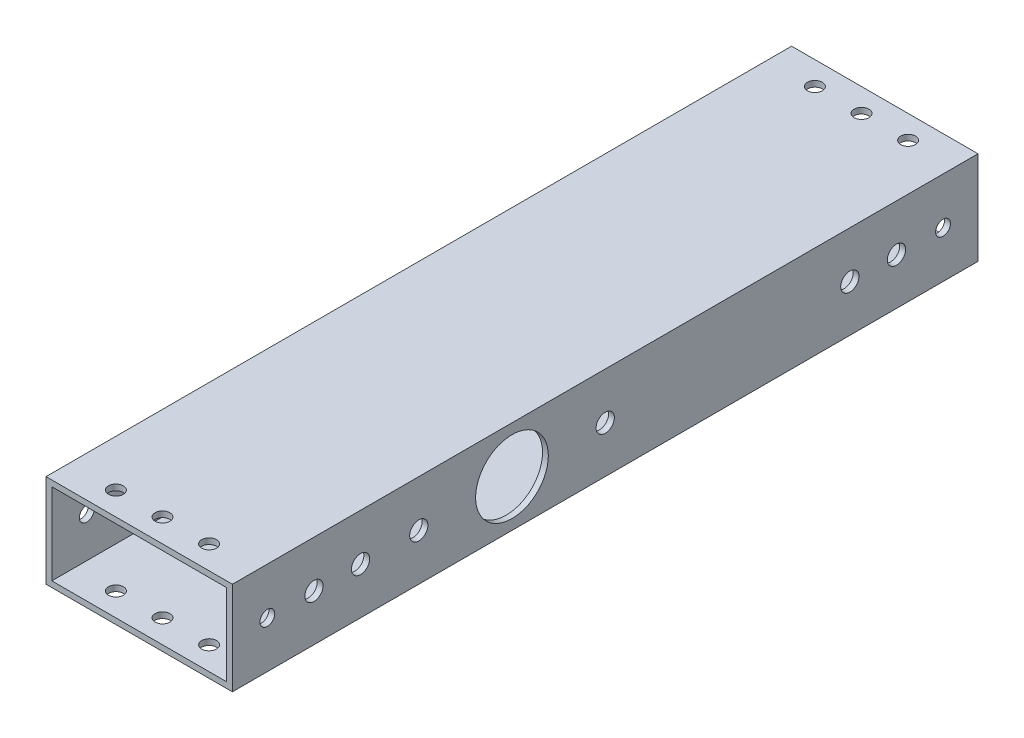
from build123d import *

# Parameters (mm, degrees)
SKETCH1_W           = 50.8
SKETCH1_H           = 25.4
SKETCH1_W_2         = 47.625
SKETCH1_H_2         = 22.225
BOSS_EXTRUDE1_DEPTH = 101.6
SKETCH2_R           = 2.0193
SKETCH2_R_2         = 2.4892
CUT_EXTRUDE1_DEPTH  = 115.3
SKETCH3_R           = 2.0193
CUT_EXTRUDE2_DEPTH  = 108.763073453
SKETCH4_R           = 9.906
SKETCH4_R_2         = 2.4892
CUT_EXTRUDE3_DEPTH  = 115.3


with BuildPart() as part:
    # Sketch1 → Boss-Extrude1 (new, symmetric)
    with BuildSketch(Plane.XY):
        Rectangle(SKETCH1_W, SKETCH1_H)
        Rectangle(SKETCH1_W_2, SKETCH1_H_2, mode=Mode.SUBTRACT)
    extrude(amount=BOSS_EXTRUDE1_DEPTH, both=True)

    # Sketch2 → Cut-Extrude1 (cut, through all)
    with BuildSketch(Plane(origin=(25.4, 0, 0), x_dir=(0, 0, -1), z_dir=(1, 0, 0))):
        with Locations((-92.075, 0)):
            Circle(SKETCH2_R)
        with Locations((92.075, 0)):
            Circle(SKETCH2_R)
        with Locations((-79.375, 0)):
            Circle(SKETCH2_R_2)
        with Locations((-66.675, 0)):
            Circle(SKETCH2_R_2)
        with Locations((66.675, 0)):
            Circle(SKETCH2_R_2)
        with Locations((79.375, 0)):
            Circle(SKETCH2_R_2)
    extrude(amount=-CUT_EXTRUDE1_DEPTH, mode=Mode.SUBTRACT)

    # Sketch3 → Cut-Extrude2 (cut, through all)
    with BuildSketch(Plane(origin=(0, 12.7, 0), x_dir=(1, 0, 0), z_dir=(0, 1, 0))):
        with Locations((-12.7, -95.25)):
            Circle(SKETCH3_R)
        with Locations((0, -95.25)):
            Circle(SKETCH3_R)
        with Locations((12.7, -95.25)):
            Circle(SKETCH3_R)
        with Locations((12.7, 95.25)):
            Circle(SKETCH3_R)
        with Locations((0, 95.25)):
            Circle(SKETCH3_R)
        with Locations((-12.7, 95.25)):
            Circle(SKETCH3_R)
    extrude(amount=-CUT_EXTRUDE2_DEPTH, mode=Mode.SUBTRACT)

    # Sketch4 → Cut-Extrude3 (cut, through all)
    with BuildSketch(Plane(origin=(25.4, 0, 0), x_dir=(0, 0, -1), z_dir=(1, 0, 0))):
        with Locations((-25.4, 0)):
            Circle(SKETCH4_R)
        with Locations((-50.8, 0)):
            Circle(SKETCH4_R_2)
        Circle(SKETCH4_R_2)
    extrude(amount=-CUT_EXTRUDE3_DEPTH, mode=Mode.SUBTRACT)


solid = part.part
